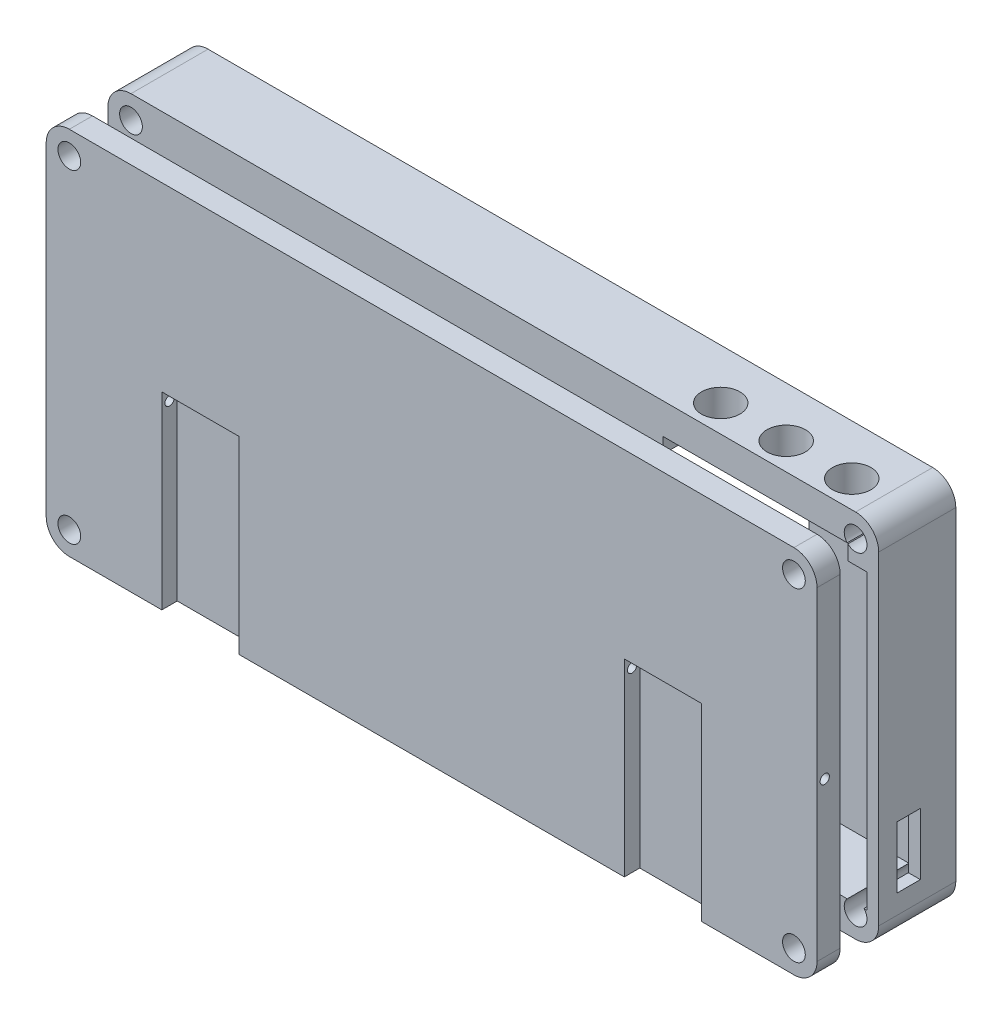
from build123d import *
from OCP.BRepFilletAPI import BRepFilletAPI_MakeChamfer

# Parameters (mm, degrees)
SKETCH_1_W                = 10
SKETCH_1_H                = 48
EXTRUDE_2_DEPTH           = 100
CUT_EXTRUDE_3_DEPTH       = 112.373246339
SKETCH_4_3_W              = 96.9
SKETCH_4_3_H              = 38
CUT_EXTRUDE_4_DEPTH       = 8
CHAMFER_4_SIZE            = 3.464101615
CHAMFER_4_SIZE_2          = 2
FILLET_1_R                = 3
SKETCH_13_W               = 24
SKETCH_13_H               = 2
CUT_EXTRUDE_17_DEPTH      = 8
CUT_EXTRUDE_18_REACH      = 113.373
SKETCH_12_R               = 2.5
CUT_EXTRUDE_19_REACH      = 113.373
SKETCH_14_W               = 3
SKETCH_14_H               = 8
CUT_EXTRUDE_20_REACH      = 113.373
SKETCH_15_W               = 4
SKETCH_15_H               = 4
CUT_EXTRUDE_START         = -8
SKETCH_16_W               = 14
SKETCH_16_H               = 2
CUT_EXTRUDE_21_DEPTH      = 8
EXTRUDE_START             = 5
EXTRUDE_3_DEPTH           = 3
SKETCH_8_W                = 10
SKETCH_8_H                = 24
CUT_EXTRUDE_9_DEPTH       = 2
CUT_EXTRUDE_10_DEPTH      = 90.604687377
CUT_EXTRUDE_10_DEPTH_BACK = 90.604687377
SKETCH_9_R                = 0.6
SKETCH_10_R               = 1.475
CUT_EXTRUDE_12_DEPTH      = 113.374374303
SKETCH_8_4_W              = 10
SKETCH_8_4_H              = 0.5
CUT_EXTRUDE_16_DEPTH      = 1


with BuildPart() as part:
    # 草图1 → 凸台-拉伸2 (new body)
    with BuildSketch(Plane(origin=(0, 0, 0), x_dir=(0, 0, -1), z_dir=(1, 0, 0))):
        with Locations((5, 24)):
            Rectangle(SKETCH_1_W, SKETCH_1_H)
    extrude(amount=EXTRUDE_2_DEPTH)

    # 草图4 → 切除-拉伸3 (cut, through all)
    with BuildSketch(Plane.XY):
        Polygon((81.945, 37.525), (82.945, 36.525), (82.945, 10.475), (81.945, 9.475), (18.055, 9.475), (17.055, 10.475), (17.055, 36.525), (18.055, 37.525), align=None)
    extrude(amount=-CUT_EXTRUDE_3_DEPTH, mode=Mode.SUBTRACT)

    # 草图4<3> → 切除-拉伸4 (cut)
    with BuildSketch(Plane.XY):
        with Locations((50, 23)):
            Rectangle(SKETCH_4_3_W, SKETCH_4_3_H)
    extrude(amount=-CUT_EXTRUDE_4_DEPTH, mode=Mode.SUBTRACT)

    # 倒角4
    chamfer_4_edges_1 = [part.edges().sort_by_distance(p)[0] for p in [
        (17.055, 23.5, -10),
    ]]
    chamfer_4_side_1 = [part.faces().sort_by_distance(p)[0] for p in [
        (17.015, 23.5, -10),
    ]]
    chamfer_4_edges_2 = [part.edges().sort_by_distance(p)[0] for p in [
        (17.555, 37.025, -10),
    ]]
    chamfer_4_side_2 = [part.faces().sort_by_distance(p)[0] for p in [
        (17.526715729, 37.053284271, -10),
    ]]
    chamfer_4_edges_3 = [part.edges().sort_by_distance(p)[0] for p in [
        (50, 37.525, -10),
    ]]
    chamfer_4_side_3 = [part.faces().sort_by_distance(p)[0] for p in [
        (50, 37.565, -10),
    ]]
    chamfer_4_edges_4 = [part.edges().sort_by_distance(p)[0] for p in [
        (82.445, 37.025, -10),
    ]]
    chamfer_4_side_4 = [part.faces().sort_by_distance(p)[0] for p in [
        (82.473284271, 37.053284271, -10),
    ]]
    chamfer_4_edges_5 = [part.edges().sort_by_distance(p)[0] for p in [
        (82.945, 23.5, -10),
    ]]
    chamfer_4_side_5 = [part.faces().sort_by_distance(p)[0] for p in [
        (82.985, 23.5, -10),
    ]]
    chamfer_4_edges_6 = [part.edges().sort_by_distance(p)[0] for p in [
        (82.445, 9.975, -10),
    ]]
    chamfer_4_side_6 = [part.faces().sort_by_distance(p)[0] for p in [
        (82.473284271, 9.946715729, -10),
    ]]
    chamfer_4_edges_7 = [part.edges().sort_by_distance(p)[0] for p in [
        (50, 9.475, -10),
    ]]
    chamfer_4_side_7 = [part.faces().sort_by_distance(p)[0] for p in [
        (50, 9.435, -10),
    ]]
    chamfer_4_edges_8 = [part.edges().sort_by_distance(p)[0] for p in [
        (17.555, 9.975, -10),
    ]]
    chamfer_4_side_8 = [part.faces().sort_by_distance(p)[0] for p in [
        (17.526715729, 9.946715729, -10),
    ]]
    chamfer_4 = BRepFilletAPI_MakeChamfer(part.part.solid().wrapped)
    for e in chamfer_4_edges_1:
        chamfer_4.Add(CHAMFER_4_SIZE - 0.0001, CHAMFER_4_SIZE_2 - 0.0001, e.wrapped, chamfer_4_side_1[0].wrapped)
    for e in chamfer_4_edges_2:
        chamfer_4.Add(CHAMFER_4_SIZE - 0.0001, CHAMFER_4_SIZE_2 - 0.0001, e.wrapped, chamfer_4_side_2[0].wrapped)
    for e in chamfer_4_edges_3:
        chamfer_4.Add(CHAMFER_4_SIZE - 0.0001, CHAMFER_4_SIZE_2 - 0.0001, e.wrapped, chamfer_4_side_3[0].wrapped)
    for e in chamfer_4_edges_4:
        chamfer_4.Add(CHAMFER_4_SIZE - 0.0001, CHAMFER_4_SIZE_2 - 0.0001, e.wrapped, chamfer_4_side_4[0].wrapped)
    for e in chamfer_4_edges_5:
        chamfer_4.Add(CHAMFER_4_SIZE - 0.0001, CHAMFER_4_SIZE_2 - 0.0001, e.wrapped, chamfer_4_side_5[0].wrapped)
    for e in chamfer_4_edges_6:
        chamfer_4.Add(CHAMFER_4_SIZE - 0.0001, CHAMFER_4_SIZE_2 - 0.0001, e.wrapped, chamfer_4_side_6[0].wrapped)
    for e in chamfer_4_edges_7:
        chamfer_4.Add(CHAMFER_4_SIZE - 0.0001, CHAMFER_4_SIZE_2 - 0.0001, e.wrapped, chamfer_4_side_7[0].wrapped)
    for e in chamfer_4_edges_8:
        chamfer_4.Add(CHAMFER_4_SIZE - 0.0001, CHAMFER_4_SIZE_2 - 0.0001, e.wrapped, chamfer_4_side_8[0].wrapped)
    add(Compound.cast(chamfer_4.Shape()), mode=Mode.REPLACE)  # a hair under: the kernel refuses the full size

    # 圆角1
    fillet_1_edges = [part.edges().sort_by_distance(p)[0] for p in [
        (100, 0, -5),
        (100, 48, -5),
        (0, 0, -5),
        (0, 48, -5),
    ]]
    fillet(fillet_1_edges, radius=FILLET_1_R)

    # 草图13 → 切除-拉伸17 (cut)
    with BuildSketch(Plane.XY):
        with Locations((84, 43)):
            Rectangle(SKETCH_13_W, SKETCH_13_H)
    extrude(amount=-CUT_EXTRUDE_17_DEPTH, mode=Mode.SUBTRACT)

    # 草图12 → 切除-拉伸18 (cut, up to next)
    with BuildSketch(Plane(origin=(0, 48, 0), x_dir=(1, 0, 0), z_dir=(0, 1, 0)), mode=Mode.PRIVATE) as cut_extrude_18_sk1:
        with Locations(Location((76, 3.5, 0), (0, 0, 270))):
            Circle(SKETCH_12_R)
    cut_extrude_18_tool1 = extrude(cut_extrude_18_sk1.sketch, amount=-CUT_EXTRUDE_18_REACH, mode=Mode.PRIVATE) & part.part
    # 草图12 → 切除-拉伸18 (cut, up to next)
    with BuildSketch(Plane(origin=(0, 48, 0), x_dir=(1, 0, 0), z_dir=(0, 1, 0)), mode=Mode.PRIVATE) as cut_extrude_18_sk2:
        with Locations(Location((93, 3.5, 0), (0, 0, 270))):
            Circle(SKETCH_12_R)
    cut_extrude_18_tool2 = extrude(cut_extrude_18_sk2.sketch, amount=-CUT_EXTRUDE_18_REACH, mode=Mode.PRIVATE) & part.part
    # 草图12 → 切除-拉伸18 (cut, up to next)
    with BuildSketch(Plane(origin=(0, 48, 0), x_dir=(1, 0, 0), z_dir=(0, 1, 0)), mode=Mode.PRIVATE) as cut_extrude_18_sk3:
        with Locations(Location((84.5, 3.5, 0), (0, 0, 270))):
            Circle(SKETCH_12_R)
    cut_extrude_18_tool3 = extrude(cut_extrude_18_sk3.sketch, amount=-CUT_EXTRUDE_18_REACH, mode=Mode.PRIVATE) & part.part
    add(cut_extrude_18_tool1.solids().sort_by_distance((76, 48, -3.5))[0], mode=Mode.SUBTRACT)
    add(cut_extrude_18_tool2.solids().sort_by_distance((93, 48, -3.5))[0], mode=Mode.SUBTRACT)
    add(cut_extrude_18_tool3.solids().sort_by_distance((84.5, 48, -3.5))[0], mode=Mode.SUBTRACT)

    # 草图14 → 切除-拉伸19 (cut, up to next)
    with BuildSketch(Plane(origin=(100, 0, 0), x_dir=(0, 0, -1), z_dir=(1, 0, 0)), mode=Mode.PRIVATE) as cut_extrude_19_sk1:
        with Locations((3.9, 9.5)):
            Rectangle(SKETCH_14_W, SKETCH_14_H)
    cut_extrude_19_tool1 = extrude(cut_extrude_19_sk1.sketch, amount=-CUT_EXTRUDE_19_REACH, mode=Mode.PRIVATE) & part.part
    add(cut_extrude_19_tool1.solids().sort_by_distance((100, 9.5, -3.9))[0], mode=Mode.SUBTRACT)

    # 草图15 → 切除-拉伸20 (cut, up to next)
    with BuildSketch(Plane.XZ, mode=Mode.PRIVATE) as cut_extrude_20_sk1:
        with Locations((70.5, -5)):
            Rectangle(SKETCH_15_W, SKETCH_15_H)
    cut_extrude_20_tool1 = extrude(cut_extrude_20_sk1.sketch, amount=-CUT_EXTRUDE_20_REACH, mode=Mode.PRIVATE) & part.part
    # 草图15 → 切除-拉伸20 (cut, up to next)
    with BuildSketch(Plane.XZ, mode=Mode.PRIVATE) as cut_extrude_20_sk2:
        with BuildLine():
            ThreePointArc((72.5, -3), (74.5, -5), (72.5, -7))
            Line((72.5, -7), (72.5, -3))
        make_face()
    cut_extrude_20_tool2 = extrude(cut_extrude_20_sk2.sketch, amount=-CUT_EXTRUDE_20_REACH, mode=Mode.PRIVATE) & part.part
    # 草图15 → 切除-拉伸20 (cut, up to next)
    with BuildSketch(Plane.XZ, mode=Mode.PRIVATE) as cut_extrude_20_sk3:
        with BuildLine():
            Line((68.5, -7), (68.5, -3))
            ThreePointArc((68.5, -3), (66.5, -5), (68.5, -7))
        make_face()
    cut_extrude_20_tool3 = extrude(cut_extrude_20_sk3.sketch, amount=-CUT_EXTRUDE_20_REACH, mode=Mode.PRIVATE) & part.part
    add(cut_extrude_20_tool1.solids().sort_by_distance((70.5, 0, -5))[0], mode=Mode.SUBTRACT)
    add(cut_extrude_20_tool2.solids().sort_by_distance((73.348826, 0, -5))[0], mode=Mode.SUBTRACT)
    add(cut_extrude_20_tool3.solids().sort_by_distance((67.651174, 0, -5))[0], mode=Mode.SUBTRACT)

    # 草图16 → 切除-拉伸21 (cut)
    with BuildSketch(Plane.XY.offset(CUT_EXTRUDE_START)):
        with Locations((70.5, 3)):
            Rectangle(SKETCH_16_W, SKETCH_16_H)
    extrude(amount=CUT_EXTRUDE_21_DEPTH, mode=Mode.SUBTRACT)


with BuildPart() as body_2:
    # 草图7 → 凸台-拉伸3 (new body)
    with BuildSketch(Plane.XY.offset(EXTRUDE_START)):
        with BuildLine():
            Line((3, 0), (97, 0))
            ThreePointArc((97, 0), (99.121320344, 0.878679656), (100, 3))
            Line((100, 3), (100, 45))
            ThreePointArc((100, 45), (99.121320344, 47.121320344), (97, 48))
            Line((97, 48), (3, 48))
            ThreePointArc((3, 48), (0.878679656, 47.121320344), (0, 45))
            Line((0, 45), (0, 3))
            ThreePointArc((0, 3), (0.878679656, 0.878679656), (3, 0))
        make_face()
    extrude(amount=EXTRUDE_3_DEPTH)

    # 草图8 → 切除-拉伸9 (cut)
    with BuildSketch(Plane.XY.offset(8)):
        with Locations((20, 12)):
            Rectangle(SKETCH_8_W, SKETCH_8_H)
        with Locations((80, 12)):
            Rectangle(SKETCH_8_W, SKETCH_8_H)
    extrude(amount=-CUT_EXTRUDE_9_DEPTH, mode=Mode.SUBTRACT)

    # 草图9 → 切除-拉伸10 (cut, two sides: drawn at the far end of the back side and taken through both)
    with BuildSketch(Plane(origin=(75, 0, 0), x_dir=(0, 0, -1), z_dir=(1, 0, 0)).offset(-CUT_EXTRUDE_10_DEPTH_BACK)):
        with Locations(Location((-7, 23, 0), (0, 0, 90))):
            Circle(SKETCH_9_R)
    extrude(amount=CUT_EXTRUDE_10_DEPTH + CUT_EXTRUDE_10_DEPTH_BACK, mode=Mode.SUBTRACT)


with BuildPart() as cut_extrude_12_tool:
    # 草图10 → 切除-拉伸12 (new, through all)
    with BuildSketch(Plane.XY.offset(8)):
        with Locations((3, 45)):
            Circle(SKETCH_10_R)
        with Locations((97, 45)):
            Circle(SKETCH_10_R)
        with Locations((97, 3)):
            Circle(SKETCH_10_R)
        with Locations((3, 3)):
            Circle(SKETCH_10_R)
    extrude(amount=-CUT_EXTRUDE_12_DEPTH)


with BuildPart() as part_1:
    add(part.part)

    # 切除-拉伸12: cut by cut_extrude_12_tool
    add(cut_extrude_12_tool.part, mode=Mode.SUBTRACT)


with BuildPart() as body_2_1:
    add(body_2.part)

    # 切除-拉伸12: cut by cut_extrude_12_tool
    add(cut_extrude_12_tool.part, mode=Mode.SUBTRACT)

    # 草图8<4> → 切除-拉伸16 (cut)
    with BuildSketch(Plane.XY.offset(8)):
        with Locations((20, 24.25)):
            Rectangle(SKETCH_8_4_W, SKETCH_8_4_H)
        with Locations((80, 24.25)):
            Rectangle(SKETCH_8_4_W, SKETCH_8_4_H)
    extrude(amount=-CUT_EXTRUDE_16_DEPTH, mode=Mode.SUBTRACT)


solid = Compound([part_1.part, body_2_1.part])
